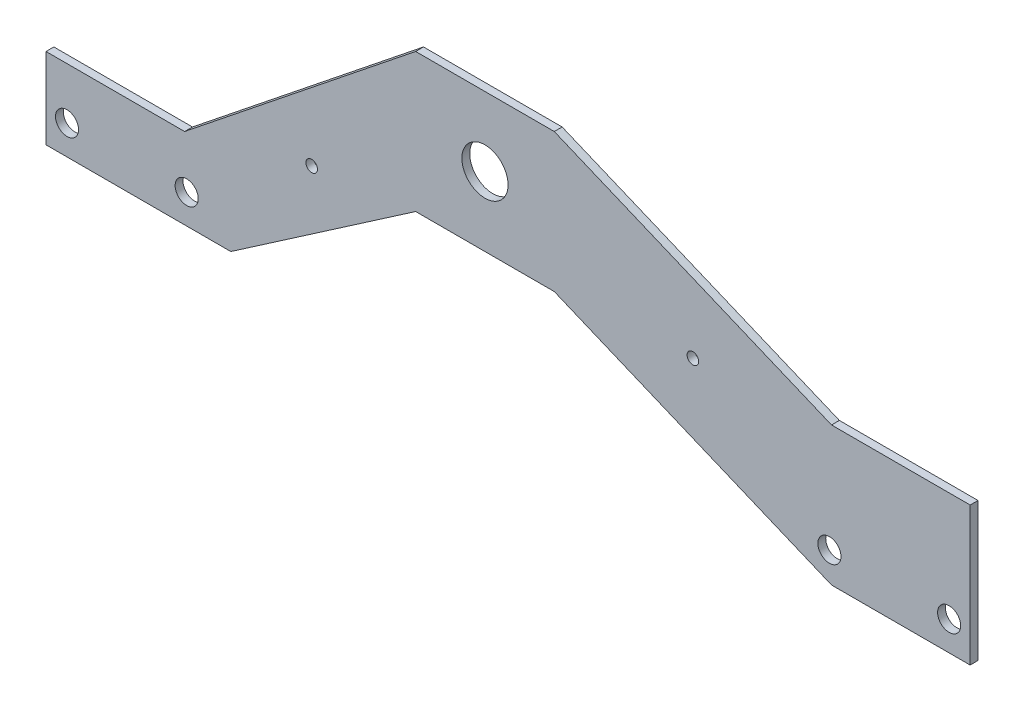
from build123d import *

# Parameters (mm, degrees)
SKETCH1_R          = 10000
SKETCH1_R_2        = 2500
BASE_FLANGE1_DEPTH = 3400
SCALE1_SCALE       = 0.001
SKETCH2_R          = 5
CUT_EXTRUDE1_DEPTH = 216644.107193969


# Sheet-metal steps are written as plain solids
with BuildPart() as part:
    # Sketch1 → Base-Flange1 (new body)
    with BuildSketch(Plane.XY):
        Polygon((0, 0), (0, -35000), (80000, -35000), (160000, 20000), (220000, 20000), (340000, -30000), (400000, -30000), (400000, 30000), (340000, 30000), (220000, 80000), (160000, 80000), (60000, 0), align=None)
        with Locations((190000, 50000)):
            Circle(SKETCH1_R, mode=Mode.SUBTRACT)
        with Locations((280000, 25000)):
            Circle(SKETCH1_R_2, mode=Mode.SUBTRACT)
        with Locations((115000, 14570.048045386)):
            Circle(SKETCH1_R_2, mode=Mode.SUBTRACT)
    extrude(amount=-BASE_FLANGE1_DEPTH)


with BuildPart() as part_1:
    # Scale1: scaled about (215693.562550425, 18131.029763925, -1700)
    add(part.part.scale(SCALE1_SCALE).moved(Location((215477.868987875, 18112.898734161, -1698.3))))

    # Sketch2 → Cut-Extrude1 (cut, through all)
    with BuildSketch(Plane(origin=(0, 0, -1701.7), x_dir=(-1, 0, 0), z_dir=(0, 0, -1))):
        with Locations((-215486.968987875, 18090.598734161)):
            Circle(SKETCH2_R)
        with Locations((-215538.768987875, 18090.598734161)):
            Circle(SKETCH2_R)
        with Locations((-215816.968987875, 18095.598734161)):
            Circle(SKETCH2_R)
        with Locations((-215868.768987875, 18095.598734161)):
            Circle(SKETCH2_R)
    extrude(amount=-CUT_EXTRUDE1_DEPTH, mode=Mode.SUBTRACT)


solid = part_1.part
